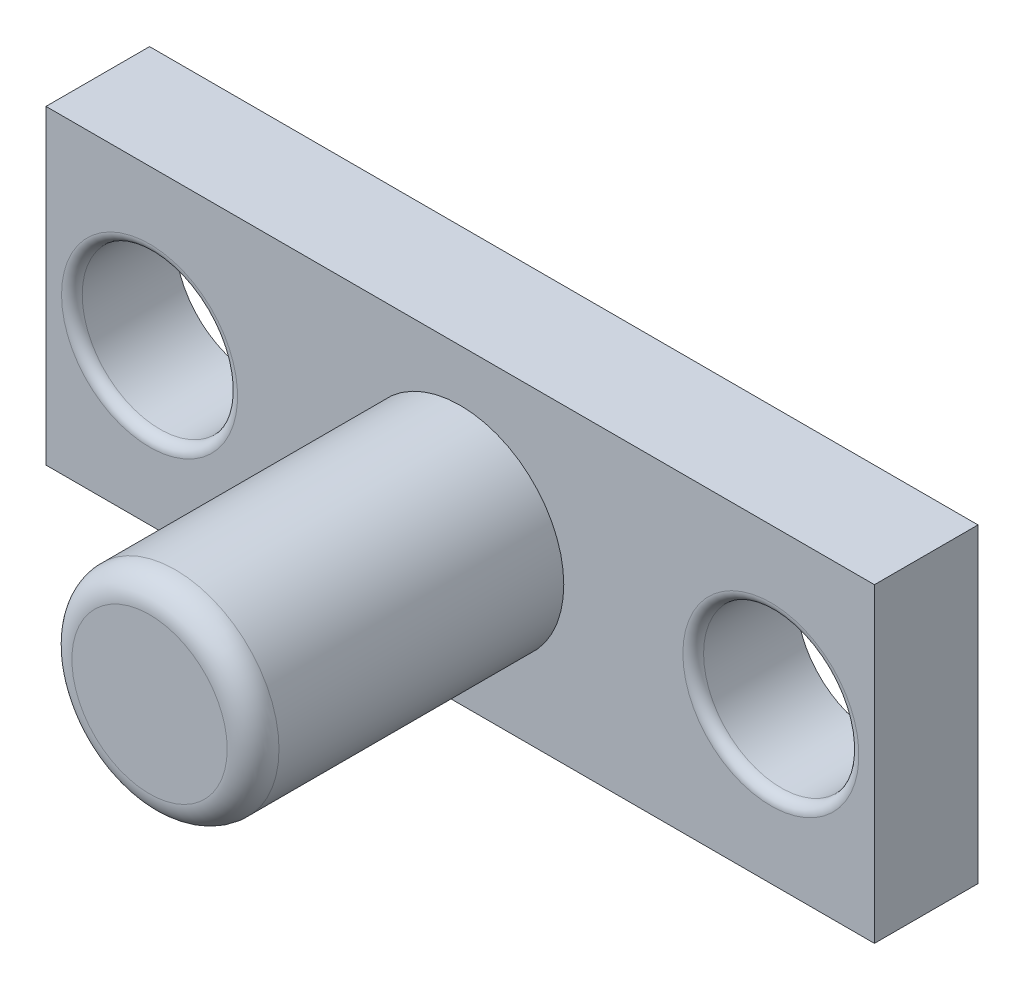
from build123d import *

# Parameters (mm, degrees)
SKETCH4_W               = 160
SKETCH4_H               = 60
BOSS_EXTRUDE1_DEPTH     = 20
SKETCH6_R               = 20
BOSS_EXTRUDE2_DEPTH     = 80
BOSS_EXTRUDE3_OUTLINE_R = 15
BOSS_EXTRUDE3_DEPTH     = 20
FILLET3_R               = 5
FILLET4_R               = 2
FILLET5_R               = 2


# Read off the part's stored shape, not the designer's step: Boss-Extrude3
with BuildPart() as part:
    # Sketch4 → Boss-Extrude1 (new body)
    with BuildSketch(Plane.XY):
        Rectangle(SKETCH4_W, SKETCH4_H)
    extrude(amount=BOSS_EXTRUDE1_DEPTH)

    # Sketch6 → Boss-Extrude2 (add)
    with BuildSketch(Plane.XY):
        with Locations(Location((0, 0, 0), (0, 0, 180))):
            Circle(SKETCH6_R)
    extrude(amount=BOSS_EXTRUDE2_DEPTH)

    # Boss-Extrude3 outline → Boss-Extrude3 (cut)
    with BuildSketch(Plane.XY):
        with Locations((60, 0)):
            Circle(BOSS_EXTRUDE3_OUTLINE_R)
        with Locations((-60, 0)):
            Circle(BOSS_EXTRUDE3_OUTLINE_R)
    extrude(amount=BOSS_EXTRUDE3_DEPTH, mode=Mode.SUBTRACT)

    # Fillet3
    fillet3_edges = [part.edges().sort_by_distance(p)[0] for p in [
        (20, 0, 80),
    ]]
    fillet(fillet3_edges, radius=FILLET3_R)

    # Fillet4
    fillet4_edges = [part.edges().sort_by_distance(p)[0] for p in [
        (-75, 0, 20),
    ]]
    fillet(fillet4_edges, radius=FILLET4_R)

    # Fillet5
    fillet5_edges = [part.edges().sort_by_distance(p)[0] for p in [
        (45, 0, 20),
    ]]
    fillet(fillet5_edges, radius=FILLET5_R)


solid = part.part
